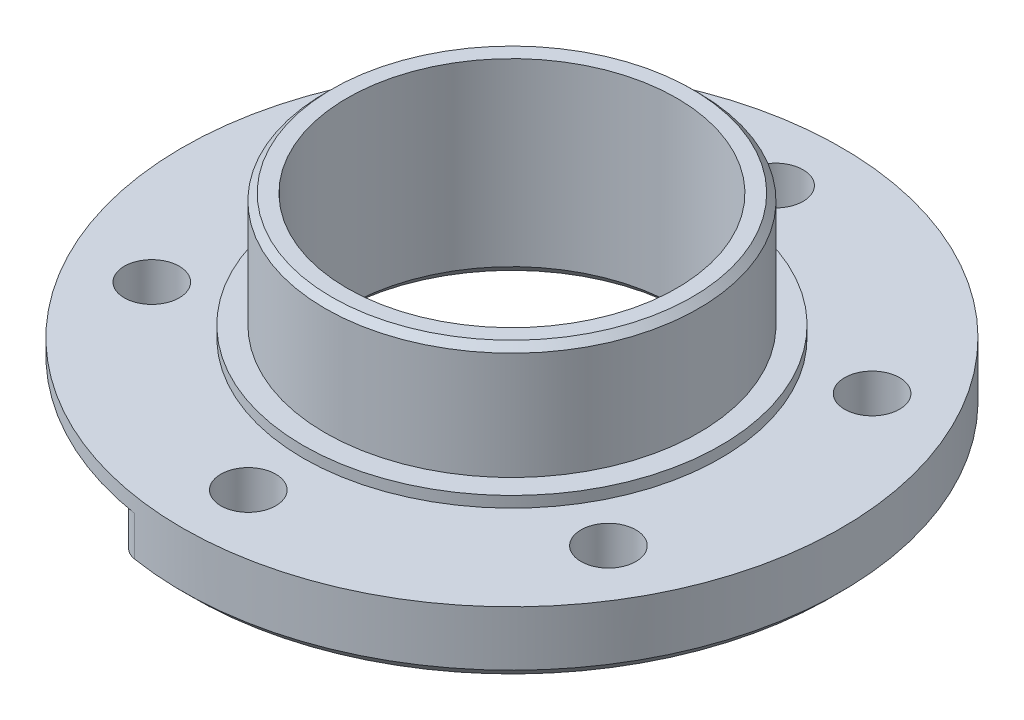
from build123d import *

# Parameters (mm, degrees)
SKETCH_1_R          = 15
SKETCH_1_R_2        = 7.5
SKETCH_1_R_3        = 1
EXTRUDE_1_DEPTH     = 3
SKETCH_2_R          = 8.5
SKETCH_2_R_2        = 7.5
EXTRUDE_2_DEPTH     = 5.7
SKETCH_3_R          = 9.5
SKETCH_3_R_2        = 8.5
EXTRUDE_3_DEPTH     = 0.5
HOLE_WIZARD_M3_1_D  = 2.5
CHAMFER_2_SIZE      = 0.3
CUT_EXTRUDE_2_DEPTH = 2.3
FILLET_2_R          = 1
CHAMFER_3_SIZE      = 0.5


with BuildPart() as part:
    # 草图1 → 凸台-拉伸1 (new body)
    with BuildSketch(Plane(origin=(0, 0, 0), x_dir=(1, 0, 0), z_dir=(0, 1, 0))):
        Circle(SKETCH_1_R)
        Circle(SKETCH_1_R_2, mode=Mode.SUBTRACT)
        with Locations((0, 12)):
            Circle(SKETCH_1_R_3, mode=Mode.SUBTRACT)
        with Locations((10.392304845, 6)):
            Circle(SKETCH_1_R_3, mode=Mode.SUBTRACT)
        with Locations((10.392304845, -6)):
            Circle(SKETCH_1_R_3, mode=Mode.SUBTRACT)
        with Locations((0, -12)):
            Circle(SKETCH_1_R_3, mode=Mode.SUBTRACT)
        with Locations((-10.392304845, -6)):
            Circle(SKETCH_1_R_3, mode=Mode.SUBTRACT)
        with Locations((-10.392304845, 6)):
            Circle(SKETCH_1_R_3, mode=Mode.SUBTRACT)
    extrude(amount=EXTRUDE_1_DEPTH)

    # 草图2 → 凸台-拉伸2 (add)
    with BuildSketch(Plane(origin=(0, 3, 0), x_dir=(1, 0, 0), z_dir=(0, 1, 0))):
        Circle(SKETCH_2_R)
        Circle(SKETCH_2_R_2, mode=Mode.SUBTRACT)
    extrude(amount=EXTRUDE_2_DEPTH)

    # 草图3 → 凸台-拉伸3 (add)
    with BuildSketch(Plane(origin=(0, 3, 0), x_dir=(1, 0, 0), z_dir=(0, 1, 0))):
        Circle(SKETCH_3_R)
        Circle(SKETCH_3_R_2, mode=Mode.SUBTRACT)
    extrude(amount=EXTRUDE_3_DEPTH)

    # M3 螺纹孔1 (through all)
    with Locations(Plane(origin=(0, 0, 0), x_dir=(-1, 0, 0), z_dir=(0, -1, 0))):
        with Locations((0, 12), (10.392304845, 6), (10.392304845, -6), (0, -12), (-10.392304845, -6), (-10.392304845, 6)):
            Hole(HOLE_WIZARD_M3_1_D / 2)

    # 倒角2
    chamfer_2_edges = [part.edges().sort_by_distance(p)[0] for p in [
        (-8.5, 8.7, 0),
    ]]
    chamfer(chamfer_2_edges, length=CHAMFER_2_SIZE)

    # 草图7 → 切除-拉伸2 (cut)
    with BuildSketch(Plane.XZ):
        with BuildLine():
            Line((-3.464101615, -2), (-12.464101615, 13.588457268))
            ThreePointArc((-12.464101615, 13.588457268), (-11, 19.052558883), (-5.535898385, 17.588457268))
            Line((-5.535898385, 17.588457268), (3.464101615, 2))
            ThreePointArc((3.464101615, 2), (2, -3.464101615), (-3.464101615, -2))
        make_face()
    extrude(amount=-CUT_EXTRUDE_2_DEPTH, mode=Mode.SUBTRACT)

    # 圆角2
    fillet_2_edges = [part.edges().sort_by_distance(p)[0] for p in [
        (-3.75, 2.3, 6.495190528),
        (0.29195723, 1.15, 7.494315244),
        (-6.636246, 1.15, 3.494315244),
        (-3.764314532, 1.15, 14.519984026),
        (-10.692517763, 1.15, 10.519984026),
    ]]
    fillet(fillet_2_edges, radius=FILLET_2_R)

    # 倒角3
    chamfer_3_edges = [part.edges().sort_by_distance(p)[0] for p in [
        (-1.557296735, 0, -7.336540525),
        (0.348322918, 0, 7.614421432),
        (-6.768443854, 0, 3.50555422),
        (-1.523538478, 0, 10.638846051),
        (-8.451741708, 0, 6.638846051),
        (-3.111088885, 0, 14.254670597),
        (-10.789362417, 0, 9.821617306),
        (-5.016376849, 0, -14.136334861),
    ]]
    chamfer(chamfer_3_edges, length=CHAMFER_3_SIZE)


solid = part.part
